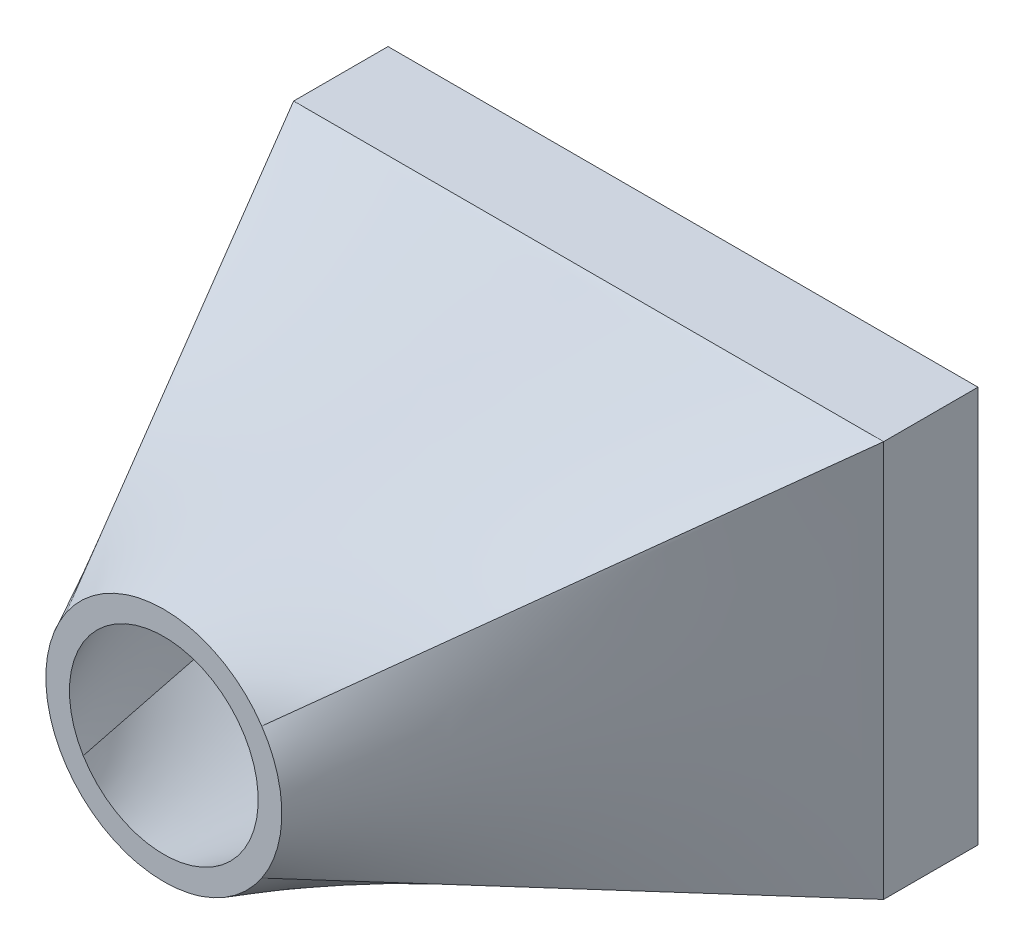
from build123d import *

# Parameters (mm, degrees)
SKETCH1_W           = 12.5
SKETCH1_H           = 8.4
SKETCH1_W_2         = 10.5
SKETCH1_H_2         = 6.4
BOSS_EXTRUDE1_DEPTH = 1
SKETCH6_W           = 12.5
SKETCH6_H           = 8.4
BOSS_EXTRUDE2_DEPTH = 1
SKETCH7_W           = 10.5
SKETCH7_H           = 6.4
CUT_EXTRUDE1_DEPTH  = 1


with BuildPart() as part:
    # Sketch1 → Boss-Extrude1 (new body)
    with BuildSketch(Plane.XY):
        Rectangle(SKETCH1_W, SKETCH1_H)
        Rectangle(SKETCH1_W_2, SKETCH1_H_2, mode=Mode.SUBTRACT)
    extrude(amount=BOSS_EXTRUDE1_DEPTH)

    # Sketch3 → Loft1 section 0
    with BuildSketch(Plane.XY.offset(1)):
        with BuildLine():
            Line((6.25, -4.2), (6.25, 4.2))
            Line((6.25, 4.2), (-6.25, 4.2))
            Line((-6.25, 4.2), (-6.25, -4.2))
            Line((-6.25, -4.2), (6.25, -4.2))
        make_face()
    # Sketch2 for Loft1 → Loft1 section 1
    with BuildSketch(Plane.XY.offset(10)):
        with BuildLine():
            # circular arc as an exact rational Bezier (weights 1, cos(half-angle), 1)
            Bezier((2.075003924, -1.394402637), (3.012042497, 0), (2.075003924, 1.394402637), weights=[1, 0.830001569, 1])
            Bezier((2.075003924, 1.394402637), (0, 4.482206096), (-2.075003924, 1.394402637), weights=[1, 0.557761055, 1])
            Bezier((-2.075003924, 1.394402637), (-3.012042497, 0), (-2.075003924, -1.394402637), weights=[1, 0.830001569, 1])
            Bezier((-2.075003924, -1.394402637), (0, -4.482206096), (2.075003924, -1.394402637), weights=[1, 0.557761055, 1])
        make_face()
    loft()

    # Cut-Loft1: read off the stored shape, not the designer's step
    # Cut-Loft1: loft between two sections, ruled curve by curve
    cut_loft1_from = [
        Edge.make_bspline([(1.707768655, -1.040925656, 10), (1.633699479, -1.162445397, 10), (1.542008876, -1.28354475, 10), (1.31984949, -1.511051231, 10), (1.189256111, -1.617336715, 10), (0.892947872, -1.797985608, 10), (0.72722112, -1.87212471, 10), (0.374256765, -1.973229171, 10), (0.187198335, -2, 10), (-0.187198335, -2, 10), (-0.374256765, -1.973229171, 10), (-0.72722112, -1.87212471, 10), (-0.892947872, -1.797985608, 10), (-1.189256111, -1.617336715, 10), (-1.31984949, -1.511051231, 10), (-1.542008876, -1.28354475, 10), (-1.633699479, -1.162445397, 10), (-1.707768655, -1.040925656, 10)], [0, 0, 0, 0, 0.125, 0.125, 0.25, 0.25, 0.375, 0.375, 0.5, 0.5, 0.625, 0.625, 0.75, 0.75, 0.875, 0.875, 1, 1, 1, 1], 3),
        Edge.make_bspline([(-1.707768655, -1.040925656, 10), (-1.798062507, -0.892787306, 10), (-1.872174068, -0.727085204, 10), (-1.973239973, -0.374182636, 10), (-2, -0.187161202, 10), (-2, 0.187161202, 10), (-1.973239973, 0.374182636, 10), (-1.872174068, 0.727085204, 10), (-1.798062507, 0.892787306, 10), (-1.707768655, 1.040925656, 10)], [0, 0, 0, 0, 0.25, 0.25, 0.5, 0.5, 0.75, 0.75, 1, 1, 1, 1], 3),
        Edge.make_bspline([(1.707768655, 1.040925656, 10), (1.798062507, 0.892787306, 10), (1.872174068, 0.727085204, 10), (1.973239973, 0.374182636, 10), (2, 0.187161202, 10), (2, -0.187161202, 10), (1.973239973, -0.374182636, 10), (1.872174068, -0.727085204, 10), (1.798062507, -0.892787306, 10), (1.707768655, -1.040925656, 10)], [0, 0, 0, 0, 0.25, 0.25, 0.5, 0.5, 0.75, 0.75, 1, 1, 1, 1], 3),
        Edge.make_bspline([(-1.707768655, 1.040925656, 10), (-1.633699479, 1.162445397, 10), (-1.542008876, 1.28354475, 10), (-1.31984949, 1.511051231, 10), (-1.189256111, 1.617336715, 10), (-0.892947872, 1.797985608, 10), (-0.72722112, 1.87212471, 10), (-0.374256765, 1.973229171, 10), (-0.187198335, 2, 10), (0.187198335, 2, 10), (0.374256765, 1.973229171, 10), (0.72722112, 1.87212471, 10), (0.892947872, 1.797985608, 10), (1.189256111, 1.617336715, 10), (1.31984949, 1.511051231, 10), (1.542008876, 1.28354475, 10), (1.633699479, 1.162445397, 10), (1.707768655, 1.040925656, 10)], [0, 0, 0, 0, 0.125, 0.125, 0.25, 0.25, 0.375, 0.375, 0.5, 0.5, 0.625, 0.625, 0.75, 0.75, 0.875, 0.875, 1, 1, 1, 1], 3),
    ]
    cut_loft1_to = [
        Edge.make_bspline([(5.25, -3.2, 1), (4.8125, -3.2, 1), (4.375, -3.2, 1), (3.5, -3.2, 1), (3.0625, -3.2, 1), (2.1875, -3.2, 1), (1.75, -3.2, 1), (0.875, -3.2, 1), (0.4375, -3.2, 1), (-0.4375, -3.2, 1), (-0.875, -3.2, 1), (-1.75, -3.2, 1), (-2.1875, -3.2, 1), (-3.0625, -3.2, 1), (-3.5, -3.2, 1), (-4.375, -3.2, 1), (-4.8125, -3.2, 1), (-5.25, -3.2, 1)], [0, 0, 0, 0, 0.125, 0.125, 0.25, 0.25, 0.375, 0.375, 0.5, 0.5, 0.625, 0.625, 0.75, 0.75, 0.875, 0.875, 1, 1, 1, 1], 3),
        Edge.make_bspline([(-5.25, -3.2, 1), (-5.25, -2.666666667, 1), (-5.25, -2.133333333, 1), (-5.25, -1.066666667, 1), (-5.25, -0.533333333, 1), (-5.25, 0.533333333, 1), (-5.25, 1.066666667, 1), (-5.25, 2.133333333, 1), (-5.25, 2.666666667, 1), (-5.25, 3.2, 1)], [0, 0, 0, 0, 0.25, 0.25, 0.5, 0.5, 0.75, 0.75, 1, 1, 1, 1], 3),
        Edge.make_bspline([(5.25, 3.2, 1), (5.25, 2.666666667, 1), (5.25, 2.133333333, 1), (5.25, 1.066666667, 1), (5.25, 0.533333333, 1), (5.25, -0.533333333, 1), (5.25, -1.066666667, 1), (5.25, -2.133333333, 1), (5.25, -2.666666667, 1), (5.25, -3.2, 1)], [0, 0, 0, 0, 0.25, 0.25, 0.5, 0.5, 0.75, 0.75, 1, 1, 1, 1], 3),
        Edge.make_bspline([(-5.25, 3.2, 1), (-4.8125, 3.2, 1), (-4.375, 3.2, 1), (-3.5, 3.2, 1), (-3.0625, 3.2, 1), (-2.1875, 3.2, 1), (-1.75, 3.2, 1), (-0.875, 3.2, 1), (-0.4375, 3.2, 1), (0.4375, 3.2, 1), (0.875, 3.2, 1), (1.75, 3.2, 1), (2.1875, 3.2, 1), (3.0625, 3.2, 1), (3.5, 3.2, 1), (4.375, 3.2, 1), (4.8125, 3.2, 1), (5.25, 3.2, 1)], [0, 0, 0, 0, 0.125, 0.125, 0.25, 0.25, 0.375, 0.375, 0.5, 0.5, 0.625, 0.625, 0.75, 0.75, 0.875, 0.875, 1, 1, 1, 1], 3),
    ]
    cut_loft1 = Solid(Shell([*[Face.make_surface_from_curves(cut_loft1_from[k], cut_loft1_to[k]) for k in range(4)], Face(Wire(cut_loft1_from)), Face(Wire(cut_loft1_to))]))
    add(cut_loft1, mode=Mode.SUBTRACT)

    # Sketch6 → Boss-Extrude2 (add)
    with BuildSketch(Plane(origin=(0, 0, 0), x_dir=(-1, 0, 0), z_dir=(0, 0, -1))):
        Rectangle(SKETCH6_W, SKETCH6_H)
    extrude(amount=BOSS_EXTRUDE2_DEPTH)

    # Sketch7 → Cut-Extrude1 (cut)
    with BuildSketch(Plane(origin=(0, 0, -1), x_dir=(-1, 0, 0), z_dir=(0, 0, -1))):
        Rectangle(SKETCH7_W, SKETCH7_H)
    extrude(amount=-CUT_EXTRUDE1_DEPTH, mode=Mode.SUBTRACT)


solid = part.part
